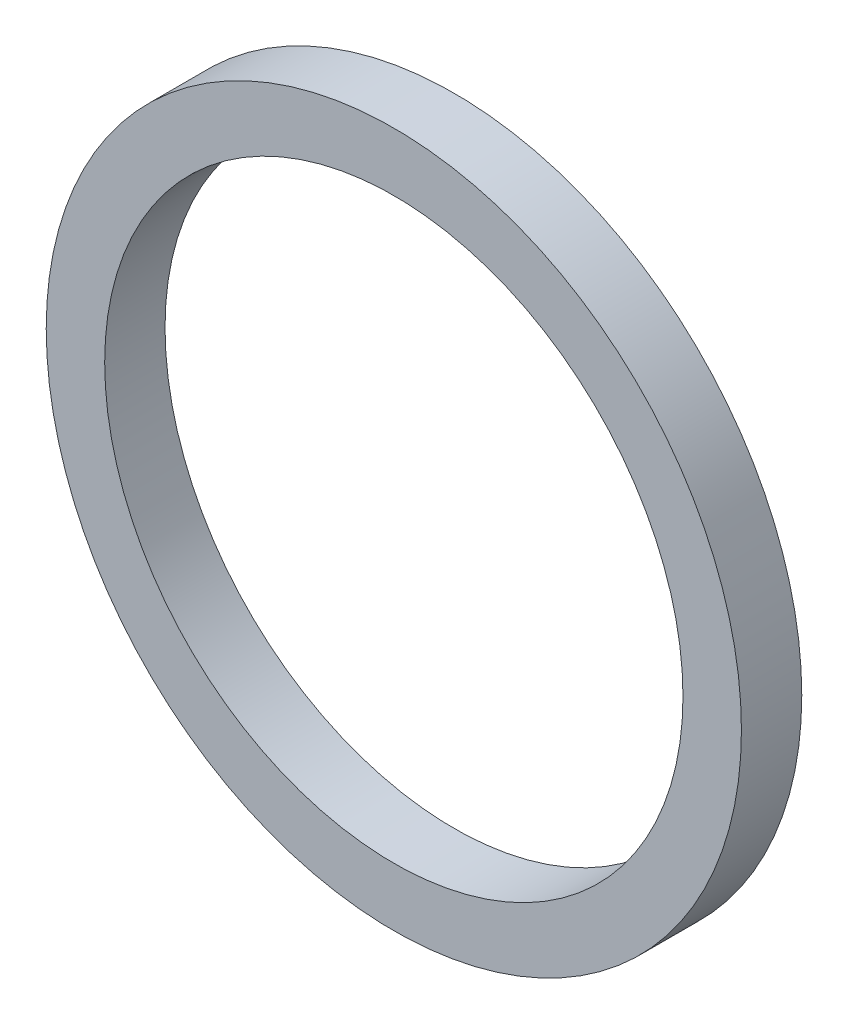
from build123d import *

# Parameters (mm, degrees)
CROQUIS3_R              = 27.65
CROQUIS3_R_2            = 23
SALIENTE_EXTRUIR2_DEPTH = 4.8


with BuildPart() as part:
    # Croquis3 → Saliente-Extruir2 (new body)
    with BuildSketch(Plane.XY.offset(7.4)):
        Circle(CROQUIS3_R)
        Circle(CROQUIS3_R_2, mode=Mode.SUBTRACT)
    extrude(amount=SALIENTE_EXTRUIR2_DEPTH)


solid = part.part
